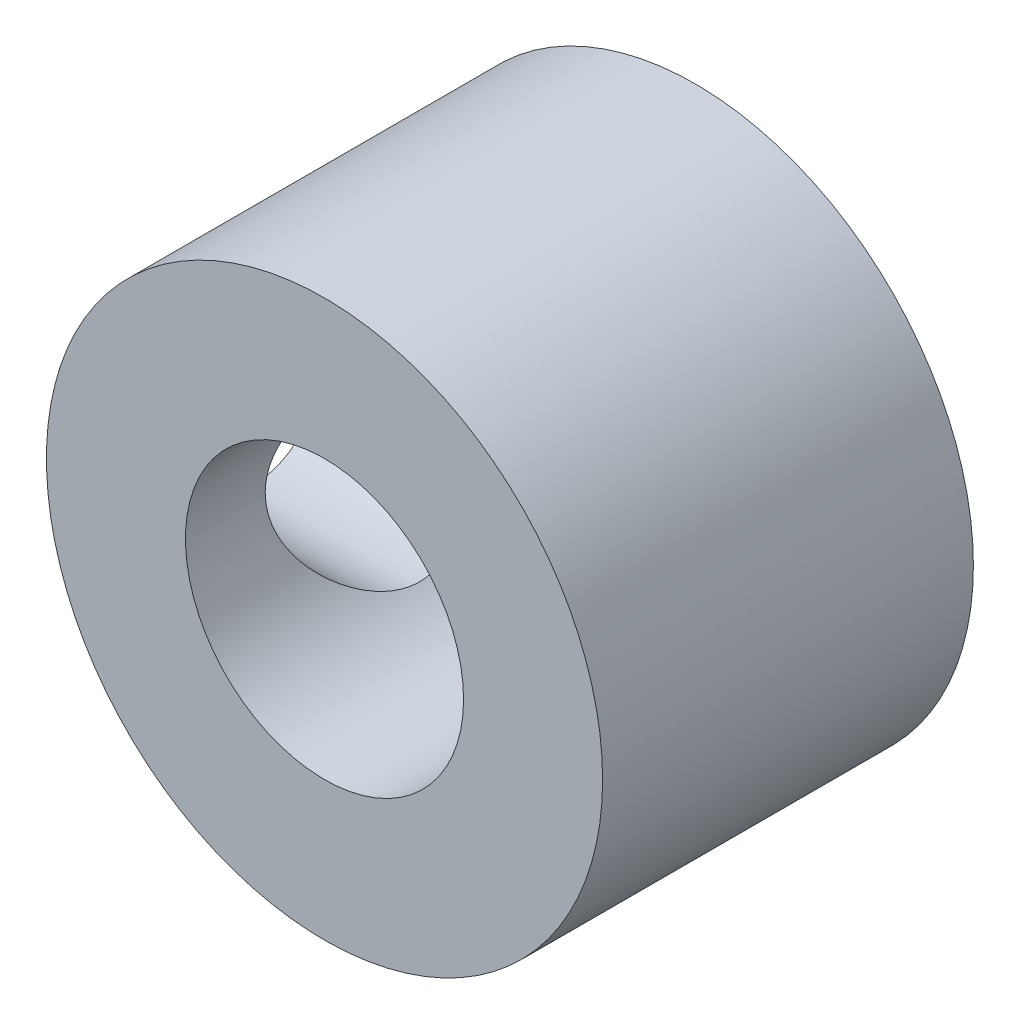
from build123d import *

# Parameters (mm, degrees)
SKETCH1_R           = 6.35
SKETCH1_R_2         = 3.175
BOSS_EXTRUDE1_DEPTH = 8.466666667
SKETCH2_R           = 2.413
CUT_EXTRUDE1_DEPTH  = 13.342181511


with BuildPart() as part:
    # Sketch1 → Boss-Extrude1 (new body)
    with BuildSketch(Plane.XY):
        Circle(SKETCH1_R)
        Circle(SKETCH1_R_2, mode=Mode.SUBTRACT)
    extrude(amount=BOSS_EXTRUDE1_DEPTH)

    # Sketch2 → Cut-Extrude1 (cut, through all)
    with BuildSketch(Plane(origin=(0, 0, 0), x_dir=(0, 0, -1), z_dir=(1, 0, 0))):
        with Locations((-4.233333333, 0)):
            Circle(SKETCH2_R)
    extrude(amount=-CUT_EXTRUDE1_DEPTH, mode=Mode.SUBTRACT)


solid = part.part
